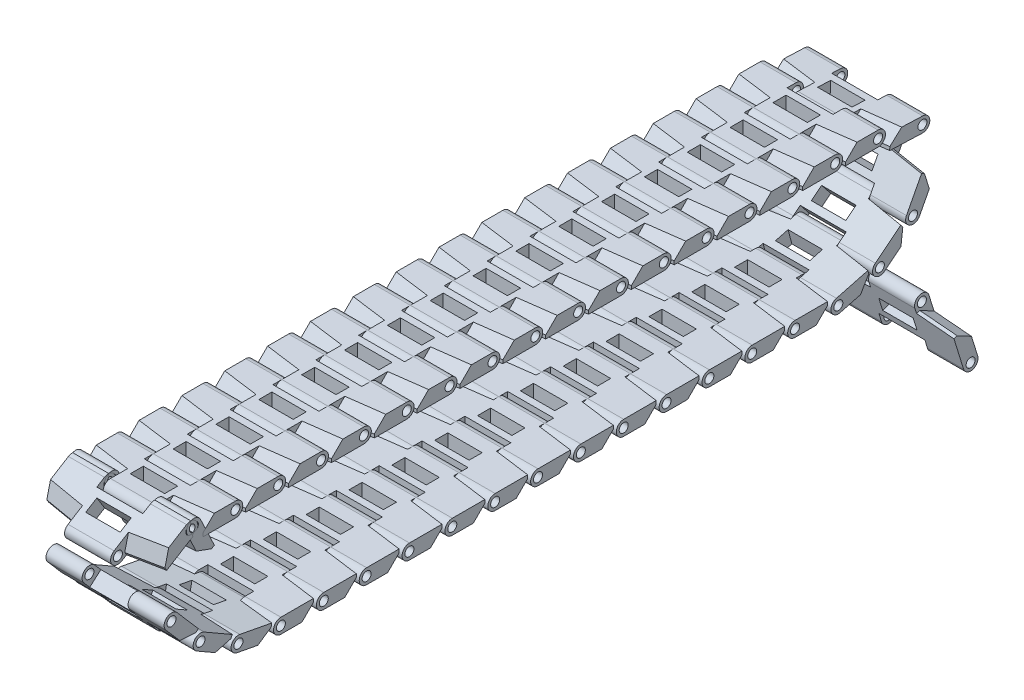
from build123d import *

# Parameters (mm, degrees)
SKETCH1_W               = 800
SKETCH1_H               = 100
BOSS_EXTRUDE1_DEPTH     = 195
CUT_EXTRUDE1_DEPTH      = 448.800178651
CUT_EXTRUDE1_DEPTH_BACK = 448.800178651
SKETCH2_W               = 311.527148746
SKETCH2_H               = 110.543776233
FILLET1_RADIUS          = 50
FILLET1_LENGTH          = 244.236425627
FILLET2_RADIUS          = 50
FILLET2_LENGTH          = 244.236425627
FILLET3_RADIUS          = 50
FILLET3_LENGTH          = 311.527148746
CUT_EXTRUDE2_DEPTH      = 448.800178652
CUT_EXTRUDE2_DEPTH_BACK = 448.800178652
SKETCH3_R               = 30.523826159
SCALE1_SCALE            = 0.52
CHAMFER1_SIZE           = 40
CUT_EXTRUDE3_DEPTH      = 235.284084623
CUT_EXTRUDE3_DEPTH_BACK = 235.284084623
SKETCH4_W               = 121.130390072
SKETCH4_H               = 45.974287776
CRVPATTERN1_ANGLE       = 180
CRVPATTERN1_3_ANGLE     = 180
CRVPATTERN1_4_ANGLE     = 177.7662294
CRVPATTERN1_6_ANGLE     = 49.0168138
CRVPATTERN1_7_ANGLE     = 180
CRVPATTERN1_9_ANGLE     = 180
CRVPATTERN1_10_ANGLE    = 14.8731289
CRVPATTERN1_11_ANGLE    = 180
CRVPATTERN1_12_ANGLE    = 180
CRVPATTERN1_14_ANGLE    = 29.8890813
CRVPATTERN1_15_ANGLE    = 180
CRVPATTERN1_17_ANGLE    = 180
CRVPATTERN1_18_ANGLE    = 38.6251484
CRVPATTERN1_19_ANGLE    = 10.7613488
CRVPATTERN1_20_ANGLE    = 180
CRVPATTERN1_21_ANGLE    = 180
CRVPATTERN1_23_ANGLE    = 180
CRVPATTERN1_25_ANGLE    = 180
CRVPATTERN1_26_ANGLE    = 62.3771678
CRVPATTERN1_28_ANGLE    = 148.25152
CRVPATTERN1_29_ANGLE    = 180
CRVPATTERN1_31_ANGLE    = 180
CRVPATTERN1_33_ANGLE    = 180
CRVPATTERN1_34_ANGLE    = 99.1686377
CRVPATTERN1_36_ANGLE    = 69.6539284
CRVPATTERN1_37_ANGLE    = 180
SCALE2_SCALE            = 0.3
BODY_MOVE_COPY1_ANGLE   = 5
BODY_MOVE_COPY4_ANGLE   = 8


with BuildPart() as part:
    # Sketch1 → Boss-Extrude1 (new, symmetric)
    with BuildSketch(Plane.XY):
        Rectangle(SKETCH1_W, SKETCH1_H)
    extrude(amount=BOSS_EXTRUDE1_DEPTH, both=True)

    # Sketch2 → Cut-Extrude1 (cut, two sides: drawn at the far end of the back side and taken through both)
    with BuildSketch(Plane(origin=(0, 0, 0), x_dir=(1, 0, 0), z_dir=(0, 1, 0)).offset(-CUT_EXTRUDE1_DEPTH_BACK)):
        Polygon((-400, 195), (-155.763574373, 195), (-155.763574373, 107.719614745), (-400, 75), align=None)
        Polygon((155.763574373, 195), (155.763574373, 107.719614745), (400, 75), (400, 195), align=None)
        with Locations((0, -139.728111883)):
            Rectangle(SKETCH2_W, SKETCH2_H)
    extrude(amount=CUT_EXTRUDE1_DEPTH + CUT_EXTRUDE1_DEPTH_BACK, mode=Mode.SUBTRACT)

    # Fillet1: full round fillet: the end face becomes a half cylinder, R = half its width
    fillet1_face = Plane((-277.881787187, 0, 195), x_dir=(1, 0, 0), z_dir=(0, 0, 1))  # on the end face: x along it, z out of the body
    fillet1_slab = fillet1_face.offset(-FILLET1_RADIUS / 2) * Box(FILLET1_LENGTH, 2 * FILLET1_RADIUS, FILLET1_RADIUS, mode=Mode.PRIVATE)  # the body's end, R deep
    fillet1_round = Plane((-277.881787187, 0, 145), x_dir=(0, 0, 1), z_dir=(1, 0, 0)) * Cylinder(FILLET1_RADIUS, FILLET1_LENGTH, mode=Mode.PRIVATE)  # its axis R under the face
    add(fillet1_slab - fillet1_round, mode=Mode.SUBTRACT)

    # Fillet2: full round fillet: the end face becomes a half cylinder, R = half its width
    fillet2_face = Plane((277.881787187, 0, 195), x_dir=(1, 0, 0), z_dir=(0, 0, 1))  # on the end face: x along it, z out of the body
    fillet2_slab = fillet2_face.offset(-FILLET2_RADIUS / 2) * Box(FILLET2_LENGTH, 2 * FILLET2_RADIUS, FILLET2_RADIUS, mode=Mode.PRIVATE)  # the body's end, R deep
    fillet2_round = Plane((277.881787187, 0, 145), x_dir=(0, 0, 1), z_dir=(1, 0, 0)) * Cylinder(FILLET2_RADIUS, FILLET2_LENGTH, mode=Mode.PRIVATE)  # its axis R under the face
    add(fillet2_slab - fillet2_round, mode=Mode.SUBTRACT)

    # Fillet3: full round fillet: the end face becomes a half cylinder, R = half its width
    fillet3_face = Plane((0, 0, -195), x_dir=(-1, 0, 0), z_dir=(0, 0, -1))  # on the end face: x along it, z out of the body
    fillet3_slab = fillet3_face.offset(-FILLET3_RADIUS / 2) * Box(FILLET3_LENGTH, 2 * FILLET3_RADIUS, FILLET3_RADIUS, mode=Mode.PRIVATE)  # the body's end, R deep
    fillet3_round = Plane((0, 0, -145), x_dir=(0, 0, -1), z_dir=(-1, 0, 0)) * Cylinder(FILLET3_RADIUS, FILLET3_LENGTH, mode=Mode.PRIVATE)  # its axis R under the face
    add(fillet3_slab - fillet3_round, mode=Mode.SUBTRACT)

    # Sketch3 → Cut-Extrude2 (cut, two sides: drawn at the far end of the back side and taken through both)
    with BuildSketch(Plane(origin=(0, 0, 0), x_dir=(0, 0, -1), z_dir=(1, 0, 0)).offset(-CUT_EXTRUDE2_DEPTH_BACK)):
        with Locations((-145, 0)):
            Circle(SKETCH3_R)
        with Locations((145, 0)):
            Circle(SKETCH3_R)
    extrude(amount=CUT_EXTRUDE2_DEPTH + CUT_EXTRUDE2_DEPTH_BACK, mode=Mode.SUBTRACT)


with BuildPart() as part_1:
    # Scale1: scaled about (0, 0, 6.745049516)
    add(part.part.scale(SCALE1_SCALE).moved(Location((0, 0, 3.237623768))))

    # Chamfer1
    chamfer1_edges = [part_1.edges().sort_by_distance(p)[0] for p in [
        (-144.498529337, -26, -44.269476066),
        (144.498529337, -26, -44.269476066),
    ]]
    chamfer(chamfer1_edges, length=CHAMFER1_SIZE)

    # Sketch4 → Cut-Extrude3 (cut, two sides: drawn at the far end of the back side and taken through both)
    with BuildSketch(Plane(origin=(0, 0, 0), x_dir=(1, 0, 0), z_dir=(0, 1, 0)).offset(-CUT_EXTRUDE3_DEPTH_BACK)):
        Rectangle(SKETCH4_W, SKETCH4_H)
    extrude(amount=CUT_EXTRUDE3_DEPTH + CUT_EXTRUDE3_DEPTH_BACK, mode=Mode.SUBTRACT)


with BuildPart() as body_2:
    # CrvPattern1: read off the stored shape, not the designer's step
    # CrvPattern1: copy of part
    add(part_1.part.moved(Location((0, -434.2179855, 738.6169165))).rotate(Axis((0, 0, 0), (1, 0, 0)), CRVPATTERN1_ANGLE))


with BuildPart() as body_3:
    # CrvPattern1 2: copy of part
    add(part_1.part.moved(Location((0, 0, -1810.7585207))))


with BuildPart() as body_4:
    # CrvPattern1 3: copy of part
    add(part_1.part.moved(Location((0, -434.2179855, -15.8658004))).rotate(Axis((0, 0, 0), (1, 0, 0)), CRVPATTERN1_3_ANGLE))


with BuildPart() as body_5:
    # CrvPattern1 4: copy of part
    add(part_1.part.moved(Location((0, -516.0198783, 2078.2039486))).rotate(Axis((0, 0, 0), (1, 0, 0)), CRVPATTERN1_4_ANGLE))


with BuildPart() as body_6:
    # CrvPattern1 5: copy of part
    add(part_1.part.moved(Location((0, 0, -452.6896302))))


with BuildPart() as body_7:
    # CrvPattern1 6: copy of part
    add(part_1.part.moved(Location((0, -215.3068166, 380.9902639))).rotate(Axis((0, 0, 0), (-1, 0, 0)), CRVPATTERN1_6_ANGLE))


with BuildPart() as body_8:
    # CrvPattern1 7: copy of part
    add(part_1.part.moved(Location((0, -434.2179855, 1342.2030901))).rotate(Axis((0, 0, 0), (1, 0, 0)), CRVPATTERN1_7_ANGLE))


with BuildPart() as body_9:
    # CrvPattern1 8: copy of part
    add(part_1.part.moved(Location((0, 0, -1207.1723471))))


with BuildPart() as body_10:
    # CrvPattern1 9: copy of part
    add(part_1.part.moved(Location((0, -434.2179855, 587.7203731))).rotate(Axis((0, 0, 0), (1, 0, 0)), CRVPATTERN1_9_ANGLE))


with BuildPart() as body_11:
    # CrvPattern1 10: copy of part
    add(part_1.part.moved(Location((0, -488.2523066, -1898.7489866))).rotate(Axis((0, 0, 0), (1, 0, 0)), CRVPATTERN1_10_ANGLE))


with BuildPart() as body_12:
    # CrvPattern1 11: copy of part
    add(part_1.part.moved(Location((0, -434.2179855, -166.7623438))).rotate(Axis((0, 0, 0), (1, 0, 0)), CRVPATTERN1_11_ANGLE))


with BuildPart() as body_13:
    # CrvPattern1 12: copy of part
    add(part_1.part.moved(Location((0, -434.2179855, 1945.7892636))).rotate(Axis((0, 0, 0), (1, 0, 0)), CRVPATTERN1_12_ANGLE))


with BuildPart() as body_14:
    # CrvPattern1 13: copy of part
    add(part_1.part.moved(Location((0, 0, -603.5861736))))


with BuildPart() as body_15:
    # CrvPattern1 14: copy of part
    add(part_1.part.moved(Location((0, -99.4541433, 281.33643))).rotate(Axis((0, 0, 0), (-1, 0, 0)), CRVPATTERN1_14_ANGLE))


with BuildPart() as body_16:
    # CrvPattern1 15: copy of part
    add(part_1.part.moved(Location((0, -434.2179855, 1191.3065467))).rotate(Axis((0, 0, 0), (1, 0, 0)), CRVPATTERN1_15_ANGLE))


with BuildPart() as body_17:
    # CrvPattern1 16: copy of part
    add(part_1.part.moved(Location((0, 0, -1358.0688905))))


with BuildPart() as body_18:
    # CrvPattern1 17: copy of part
    add(part_1.part.moved(Location((0, -434.2179855, 436.8238297))).rotate(Axis((0, 0, 0), (1, 0, 0)), CRVPATTERN1_17_ANGLE))


with BuildPart() as body_19:
    # CrvPattern1 18: copy of part
    add(part_1.part.moved(Location((0, -1237.5082792, -1689.3905714))).rotate(Axis((0, 0, 0), (1, 0, 0)), CRVPATTERN1_18_ANGLE))


with BuildPart() as body_20:
    # CrvPattern1 19: copy of part
    add(part_1.part.moved(Location((0, -22.6517411, 149.2223902))).rotate(Axis((0, 0, 0), (-1, 0, 0)), CRVPATTERN1_19_ANGLE))


with BuildPart() as body_21:
    # CrvPattern1 20: copy of part
    add(part_1.part.moved(Location((0, -434.2179855, -317.6588872))).rotate(Axis((0, 0, 0), (1, 0, 0)), CRVPATTERN1_20_ANGLE))


with BuildPart() as body_22:
    # CrvPattern1 21: copy of part
    add(part_1.part.moved(Location((0, -434.2179855, 1794.8927202))).rotate(Axis((0, 0, 0), (1, 0, 0)), CRVPATTERN1_21_ANGLE))


with BuildPart() as body_23:
    # CrvPattern1 22: copy of part
    add(part_1.part.moved(Location((0, 0, -754.4827169))))


with BuildPart() as body_24:
    # CrvPattern1 23: copy of part
    add(part_1.part.moved(Location((0, -434.2179855, 1040.4100033))).rotate(Axis((0, 0, 0), (1, 0, 0)), CRVPATTERN1_23_ANGLE))


with BuildPart() as body_25:
    # CrvPattern1 24: copy of part
    add(part_1.part.moved(Location((0, 0, -1508.9654339))))


with BuildPart() as body_26:
    # CrvPattern1 25: copy of part
    add(part_1.part.moved(Location((0, -434.2179855, 285.9272864))).rotate(Axis((0, 0, 0), (1, 0, 0)), CRVPATTERN1_25_ANGLE))


with BuildPart() as body_27:
    # CrvPattern1 26: copy of part
    add(part_1.part.moved(Location((0, -1838.9750728, -1195.9808482))).rotate(Axis((0, 0, 0), (1, 0, 0)), CRVPATTERN1_26_ANGLE))


with BuildPart() as body_28:
    # CrvPattern1 27: copy of part
    add(part_1.part.moved(Location((0, 0, -150.8965434))))


with BuildPart() as body_29:
    # CrvPattern1 28: copy of part
    add(part_1.part.moved(Location((0, -593.6979506, -178.485209))).rotate(Axis((0, 0, 0), (-1, 0, 0)), CRVPATTERN1_28_ANGLE))


with BuildPart() as body_30:
    # CrvPattern1 29: copy of part
    add(part_1.part.moved(Location((0, -434.2179855, 1643.9961768))).rotate(Axis((0, 0, 0), (1, 0, 0)), CRVPATTERN1_29_ANGLE))


with BuildPart() as body_31:
    # CrvPattern1 30: copy of part
    add(part_1.part.moved(Location((0, 0, -905.3792603))))


with BuildPart() as body_32:
    # CrvPattern1 31: copy of part
    add(part_1.part.moved(Location((0, -434.2179855, 889.5134599))).rotate(Axis((0, 0, 0), (1, 0, 0)), CRVPATTERN1_31_ANGLE))


with BuildPart() as body_33:
    # CrvPattern1 32: copy of part
    add(part_1.part.moved(Location((0, 0, -1659.8619773))))


with BuildPart() as body_34:
    # CrvPattern1 33: copy of part
    add(part_1.part.moved(Location((0, -434.2179855, 135.030743))).rotate(Axis((0, 0, 0), (1, 0, 0)), CRVPATTERN1_33_ANGLE))


with BuildPart() as body_35:
    # CrvPattern1 34: copy of part
    add(part_1.part.moved(Location((0, -2240.7321999, 3.8007836))).rotate(Axis((0, 0, 0), (1, 0, 0)), CRVPATTERN1_34_ANGLE))


with BuildPart() as body_36:
    # CrvPattern1 35: copy of part
    add(part_1.part.moved(Location((0, 0, -301.7930868))))


with BuildPart() as body_37:
    # CrvPattern1 36: copy of part
    add(part_1.part.moved(Location((0, -369.0917933, 427.6397603))).rotate(Axis((0, 0, 0), (-1, 0, 0)), CRVPATTERN1_36_ANGLE))


with BuildPart() as body_38:
    # CrvPattern1 37: copy of part
    add(part_1.part.moved(Location((0, -434.2179855, 1493.0996335))).rotate(Axis((0, 0, 0), (1, 0, 0)), CRVPATTERN1_37_ANGLE))


with BuildPart() as body_39:
    # CrvPattern1 38: copy of part
    add(part_1.part.moved(Location((0, 0, -1056.2758037))))


with BuildPart() as body_39_1:
    # Scale2: scaled about (0, 0, 0)
    add(body_39.part.scale(SCALE2_SCALE))


with BuildPart() as body_38_1:
    # Scale2: scaled about (0, 0, 0)
    add(body_38.part.scale(SCALE2_SCALE))


with BuildPart() as body_37_1:
    # Scale2: scaled about (0, 0, 0)
    add(body_37.part.scale(SCALE2_SCALE))


with BuildPart() as body_36_1:
    # Scale2: scaled about (0, 0, 0)
    add(body_36.part.scale(SCALE2_SCALE))


with BuildPart() as body_35_1:
    # Scale2: scaled about (0, 0, 0)
    add(body_35.part.scale(SCALE2_SCALE))


with BuildPart() as body_34_1:
    # Scale2: scaled about (0, 0, 0)
    add(body_34.part.scale(SCALE2_SCALE))


with BuildPart() as body_33_1:
    # Scale2: scaled about (0, 0, 0)
    add(body_33.part.scale(SCALE2_SCALE))


with BuildPart() as body_32_1:
    # Scale2: scaled about (0, 0, 0)
    add(body_32.part.scale(SCALE2_SCALE))


with BuildPart() as body_31_1:
    # Scale2: scaled about (0, 0, 0)
    add(body_31.part.scale(SCALE2_SCALE))


with BuildPart() as body_30_1:
    # Scale2: scaled about (0, 0, 0)
    add(body_30.part.scale(SCALE2_SCALE))


with BuildPart() as body_29_1:
    # Scale2: scaled about (0, 0, 0)
    add(body_29.part.scale(SCALE2_SCALE))


with BuildPart() as body_28_1:
    # Scale2: scaled about (0, 0, 0)
    add(body_28.part.scale(SCALE2_SCALE))


with BuildPart() as body_27_1:
    # Scale2: scaled about (0, 0, 0)
    add(body_27.part.scale(SCALE2_SCALE))


with BuildPart() as body_26_1:
    # Scale2: scaled about (0, 0, 0)
    add(body_26.part.scale(SCALE2_SCALE))


with BuildPart() as body_25_1:
    # Scale2: scaled about (0, 0, 0)
    add(body_25.part.scale(SCALE2_SCALE))


with BuildPart() as body_24_1:
    # Scale2: scaled about (0, 0, 0)
    add(body_24.part.scale(SCALE2_SCALE))


with BuildPart() as body_23_1:
    # Scale2: scaled about (0, 0, 0)
    add(body_23.part.scale(SCALE2_SCALE))


with BuildPart() as body_22_1:
    # Scale2: scaled about (0, 0, 0)
    add(body_22.part.scale(SCALE2_SCALE))


with BuildPart() as body_21_1:
    # Scale2: scaled about (0, 0, 0)
    add(body_21.part.scale(SCALE2_SCALE))


with BuildPart() as part_2:
    # Scale2: scaled about (0, 0, 0)
    add(part_1.part.scale(SCALE2_SCALE))


with BuildPart() as body_20_1:
    # Scale2: scaled about (0, 0, 0)
    add(body_20.part.scale(SCALE2_SCALE))


with BuildPart() as body_19_1:
    # Scale2: scaled about (0, 0, 0)
    add(body_19.part.scale(SCALE2_SCALE))


with BuildPart() as body_18_1:
    # Scale2: scaled about (0, 0, 0)
    add(body_18.part.scale(SCALE2_SCALE))


with BuildPart() as body_17_1:
    # Scale2: scaled about (0, 0, 0)
    add(body_17.part.scale(SCALE2_SCALE))


with BuildPart() as body_16_1:
    # Scale2: scaled about (0, 0, 0)
    add(body_16.part.scale(SCALE2_SCALE))


with BuildPart() as body_15_1:
    # Scale2: scaled about (0, 0, 0)
    add(body_15.part.scale(SCALE2_SCALE))


with BuildPart() as body_14_1:
    # Scale2: scaled about (0, 0, 0)
    add(body_14.part.scale(SCALE2_SCALE))


with BuildPart() as body_13_1:
    # Scale2: scaled about (0, 0, 0)
    add(body_13.part.scale(SCALE2_SCALE))


with BuildPart() as body_12_1:
    # Scale2: scaled about (0, 0, 0)
    add(body_12.part.scale(SCALE2_SCALE))


with BuildPart() as body_11_1:
    # Scale2: scaled about (0, 0, 0)
    add(body_11.part.scale(SCALE2_SCALE))


with BuildPart() as body_10_1:
    # Scale2: scaled about (0, 0, 0)
    add(body_10.part.scale(SCALE2_SCALE))


with BuildPart() as body_9_1:
    # Scale2: scaled about (0, 0, 0)
    add(body_9.part.scale(SCALE2_SCALE))


with BuildPart() as body_8_1:
    # Scale2: scaled about (0, 0, 0)
    add(body_8.part.scale(SCALE2_SCALE))


with BuildPart() as body_7_1:
    # Scale2: scaled about (0, 0, 0)
    add(body_7.part.scale(SCALE2_SCALE))


with BuildPart() as body_6_1:
    # Scale2: scaled about (0, 0, 0)
    add(body_6.part.scale(SCALE2_SCALE))


with BuildPart() as body_5_1:
    # Scale2: scaled about (0, 0, 0)
    add(body_5.part.scale(SCALE2_SCALE))


with BuildPart() as body_4_1:
    # Scale2: scaled about (0, 0, 0)
    add(body_4.part.scale(SCALE2_SCALE))


with BuildPart() as body_3_1:
    # Scale2: scaled about (0, 0, 0)
    add(body_3.part.scale(SCALE2_SCALE))


with BuildPart() as body_2_1:
    # Scale2: scaled about (0, 0, 0)
    add(body_2.part.scale(SCALE2_SCALE))


with BuildPart() as body_37_2:
    # Body-Move/Copy1: moved
    add(body_37_1.part.rotate(Axis((0, 362.639686469, 534.581134483), (1, 0, 0)), BODY_MOVE_COPY1_ANGLE))


with BuildPart() as body_37_3:
    # Body-Move/Copy2: moved
    add(body_37_2.part.moved(Location((0, -1.489690443, -19.944443396))))


with BuildPart() as body_5_2:
    # Body-Move/Copy3: moved
    add(body_5_1.part.moved(Location((0, -9.872236321, -1.593408304))))


with BuildPart() as body_35_2:
    # Body-Move/Copy4: moved
    add(body_35_1.part.rotate(Axis((0, 248, -2161), (1, 0, 0)), BODY_MOVE_COPY4_ANGLE))


solid = Compound([body_39_1.part, body_38_1.part, body_36_1.part, body_34_1.part, body_33_1.part, body_32_1.part, body_31_1.part, body_30_1.part, body_29_1.part, body_28_1.part, body_27_1.part, body_26_1.part, body_25_1.part, body_24_1.part, body_23_1.part, body_22_1.part, body_21_1.part, part_2.part, body_20_1.part, body_19_1.part, body_18_1.part, body_17_1.part, body_16_1.part, body_15_1.part, body_14_1.part, body_13_1.part, body_12_1.part, body_11_1.part, body_10_1.part, body_9_1.part, body_8_1.part, body_7_1.part, body_6_1.part, body_4_1.part, body_3_1.part, body_2_1.part, body_37_3.part, body_5_2.part, body_35_2.part])
